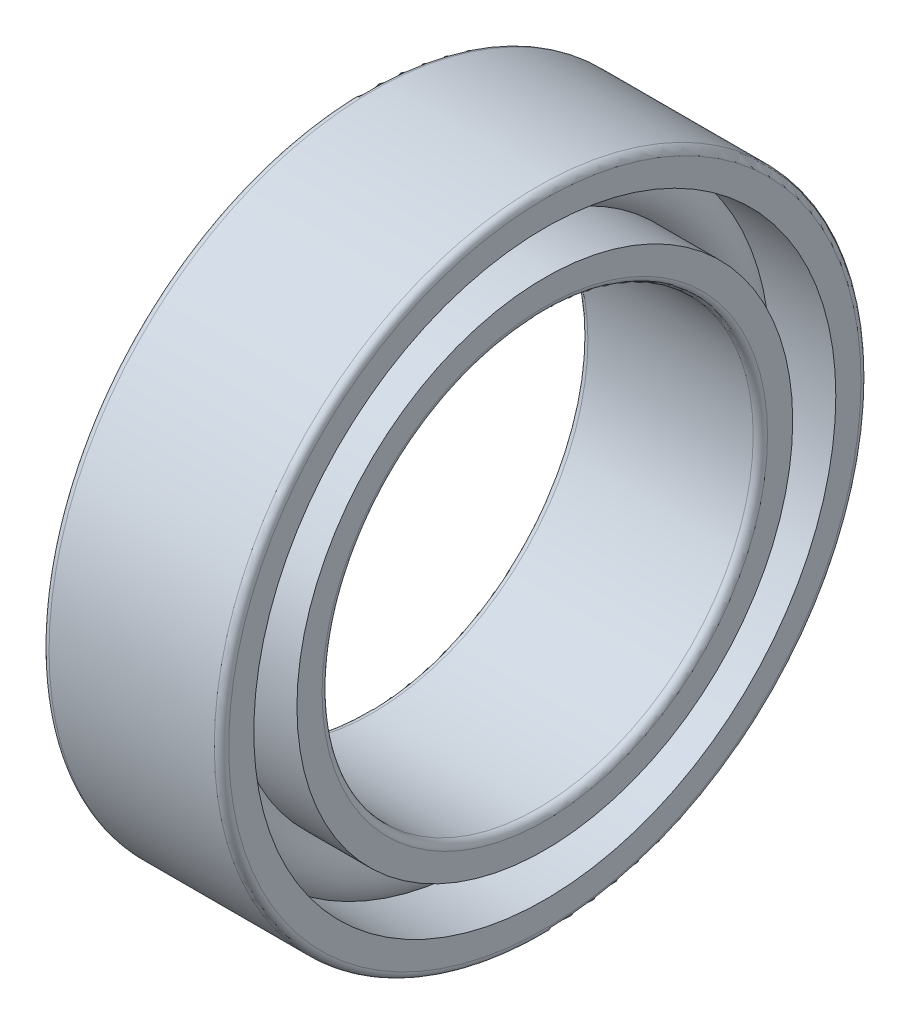
from build123d import *

# Parameters (mm, degrees)
CAGSPISKE_W     = 0.18
CAGSPISKE_H     = 0.3
CAGESPINE_ANGLE = 0.001
BALSIMSKE_R     = 0.9
SCALE1_SCALE    = 0.317565217


with BuildPart() as part:
    # CagSpiSke → CageSpine (revolve)
    with BuildSketch(Plane.XY):
        with Locations((0, 7.5)):
            Rectangle(CAGSPISKE_W, CAGSPISKE_H)
    revolve(axis=Axis((-20.6375, 0, 0), (-1, 0, 0)), revolution_arc=CAGESPINE_ANGLE)

    # BalSimSke → BallsSimplified (revolve)
    with BuildSketch(Plane.XY):
        with Locations((0, 7.5)):
            Circle(BALSIMSKE_R)
    revolve(axis=Axis((-10, 0, 0), (1, 0, 0)))

    # InnRacSke → InnerRace (revolve)
    with BuildSketch(Plane.XY):
        with BuildLine():
            Line((-0.63688696, 6.9), (-2.5, 6.9))
            Line((-2.5, 6.9), (-2.5, 6.2))
            ThreePointArc((-2.5, 6.2), (-2.441421356, 6.058578644), (-2.3, 6))
            Line((-2.3, 6), (2.3, 6))
            ThreePointArc((2.3, 6), (2.441421356, 6.058578644), (2.5, 6.2))
            Line((2.5, 6.2), (2.5, 6.9))
            Line((2.5, 6.9), (0.63688696, 6.9))
            ThreePointArc((0.63688696, 6.9), (0, 6.625), (-0.63688696, 6.9))
        make_face()
    revolve(axis=Axis((-20.6375, 0, 0), (1, 0, 0)))

    # OutRacSke → OuterRace (revolve)
    with BuildSketch(Plane.XY):
        with BuildLine():
            Line((-0.63688696, 8.1), (-2.5, 8.1))
            Line((-2.5, 8.1), (-2.5, 8.8))
            ThreePointArc((-2.5, 8.8), (-2.441421356, 8.941421356), (-2.3, 9))
            Line((-2.3, 9), (2.3, 9))
            ThreePointArc((2.3, 9), (2.441421356, 8.941421356), (2.5, 8.8))
            Line((2.5, 8.8), (2.5, 8.1))
            Line((2.5, 8.1), (0.63688696, 8.1))
            ThreePointArc((0.63688696, 8.1), (0, 8.375), (-0.63688696, 8.1))
        make_face()
    revolve(axis=Axis((-20.6375, 0, 0), (1, 0, 0)))


with BuildPart() as part_1:
    # Scale1: scaled about (0, 0, 0)
    add(part.part.scale(SCALE1_SCALE))


solid = part_1.part
